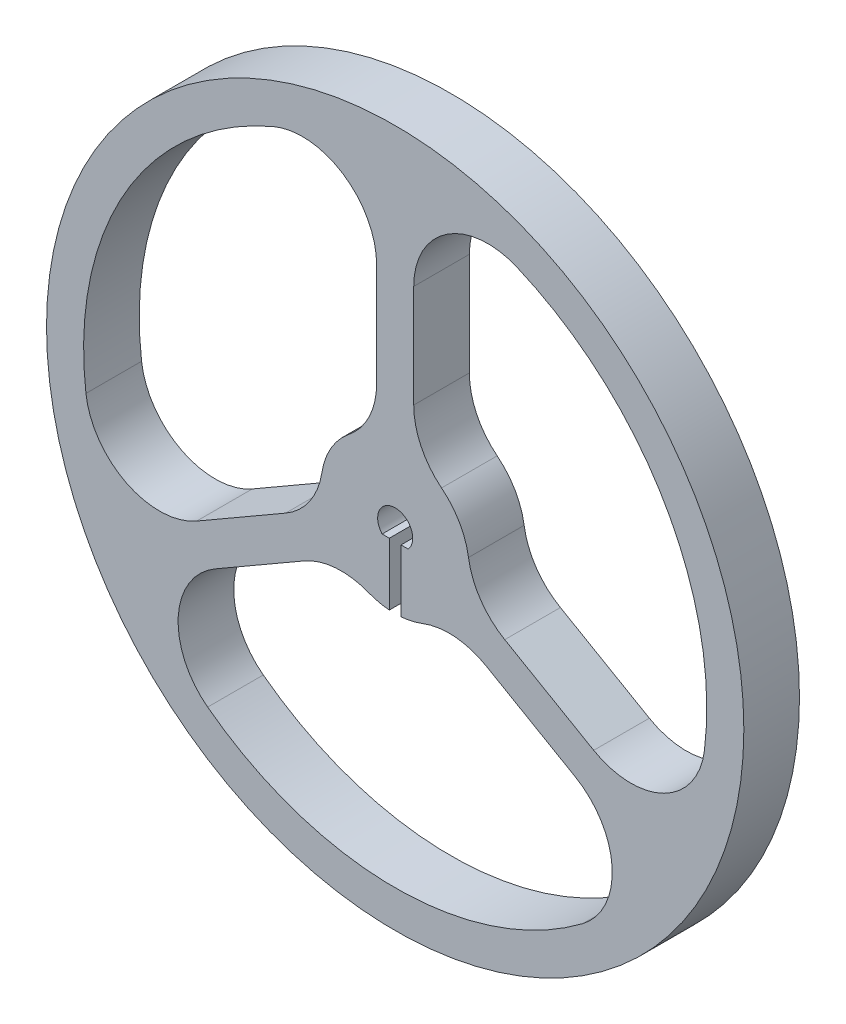
from build123d import *
from OCP.BRepAlgoAPI import BRepAlgoAPI_Cut
from OCP.TopTools import TopTools_ListOfShape

# Parameters (mm, degrees)
BOSS_EXTRUDE1_OUTLINE_R = 29.845
BOSS_EXTRUDE1_DEPTH     = 4.7625
FILLET1_R               = 6.35
CUT_EXTRUDE1_DEPTH      = 43.475049227


with BuildPart() as part:
    # Boss-Extrude1: read off the stored shape, not the designer's step
    # Boss-Extrude1 outline → Boss-Extrude1 (new body)
    with BuildSketch(Plane.XY):
        with Locations((2.773e-06, -3.1e-06)):
            Circle(BOSS_EXTRUDE1_OUTLINE_R)
        with BuildLine():
            Line((4.530888578, -4.449000046), (22.26219582, -14.686175534))
            ThreePointArc((22.26219582, -14.686175534), (-1.522e-06, -26.6700031), (-22.262195004, -14.686168364))
            Line((-22.262195004, -14.686168364), (-4.530889051, -4.448993916))
            ThreePointArc((-4.530889051, -4.448993916), (-1.522e-06, -6.3500031), (4.530888578, -4.449000046))
        make_face(mode=Mode.SUBTRACT)
        with BuildLine():
            Line((-6.11838599, -1.699361492), (-23.849694433, -11.936537069))
            ThreePointArc((-23.849694433, -11.936537069), (-23.096893005, 13.334999916), (-1.587497227, 26.622707951))
            Line((-1.587497227, 26.622707951), (-1.587497227, 6.148357962))
            ThreePointArc((-1.587497227, 6.148357962), (-5.499256774, 3.174999961), (-6.11838599, -1.699361492))
        make_face(mode=Mode.SUBTRACT)
        with BuildLine():
            Line((1.118068907, -0.999933056), (-1.118065826, -0.9999303))
            ThreePointArc((-1.118065826, -0.9999303), (4.622e-06, 1.499974165), (1.118068907, -0.999933056))
        make_face(mode=Mode.SUBTRACT)
        with BuildLine():
            Line((1.587502773, 6.148357962), (1.587502773, 26.622707951))
            ThreePointArc((1.587502773, 26.622707951), (23.096900555, 13.334996444), (23.849696391, -11.936544238))
            Line((23.849696391, -11.936544238), (6.118389237, -1.69936977))
            ThreePointArc((6.118389237, -1.69936977), (5.499264467, 3.17499624), (1.587502773, 6.148357962))
        make_face(mode=Mode.SUBTRACT)
    extrude(amount=BOSS_EXTRUDE1_DEPTH)

    # Fillet1
    fillet1_edges = [part.edges().sort_by_distance(p)[0] for p in [
        (4.530888578, -4.449000046, 2.38125),
        (-4.530889051, -4.448993916, 2.38125),
        (-22.262195004, -14.686168364, 2.38125),
        (22.26219582, -14.686175534, 2.38125),
        (-23.849694433, -11.936537069, 2.38125),
        (-6.11838599, -1.699361492, 2.38125),
        (-1.587497227, 6.148357962, 2.38125),
        (-1.587497227, 26.622707951, 2.38125),
        (1.587502773, 26.622707951, 2.38125),
        (1.587502773, 6.148357962, 2.38125),
        (6.118389237, -1.69936977, 2.38125),
        (23.849696391, -11.936544238, 2.38125),
    ]]
    fillet(fillet1_edges, radius=FILLET1_R)


with BuildPart() as cut_extrude1_tool:
    # Sketch2 → Cut-Extrude1 (new, through all)
    with BuildSketch(Plane.XY.offset(4.7625)):
        with BuildLine():
            Line((0.500000016, -0.999931678), (0, -0.999931678))
            Line((0, -0.999931678), (0, -6.3500031))
            ThreePointArc((0, -6.3500031), (0.250194284, -6.345072384), (0.500000016, -6.330287672))
            Line((0.500000016, -6.330287672), (0.500000016, -0.999931678))
        make_face()
        with BuildLine():
            Line((0, -6.3500031), (0, -0.999931678))
            Line((0, -0.999931678), (-0.500000016, -0.999931678))
            Line((-0.500000016, -0.999931678), (-0.500000016, -6.330287234))
            ThreePointArc((-0.500000016, -6.330287234), (-0.250194288, -6.345072165), (0, -6.3500031))
        make_face()
    extrude(amount=-CUT_EXTRUDE1_DEPTH)


with BuildPart() as part_1:
    add(part.part)

    # Cut-Extrude1: cut by cut_extrude1_tool, with a tolerance
    cut_extrude1_stock = TopTools_ListOfShape()
    cut_extrude1_stock.Append(part_1.part.wrapped)
    cut_extrude1_tools = TopTools_ListOfShape()
    cut_extrude1_tools.Append(cut_extrude1_tool.part.wrapped)
    cut_extrude1_cut = BRepAlgoAPI_Cut()
    cut_extrude1_cut.SetArguments(cut_extrude1_stock)
    cut_extrude1_cut.SetTools(cut_extrude1_tools)
    cut_extrude1_cut.SetFuzzyValue(0.00001)
    cut_extrude1_cut.Build()
    add(Compound.cast(cut_extrude1_cut.Shape()).solids(), mode=Mode.REPLACE)


solid = part_1.part
